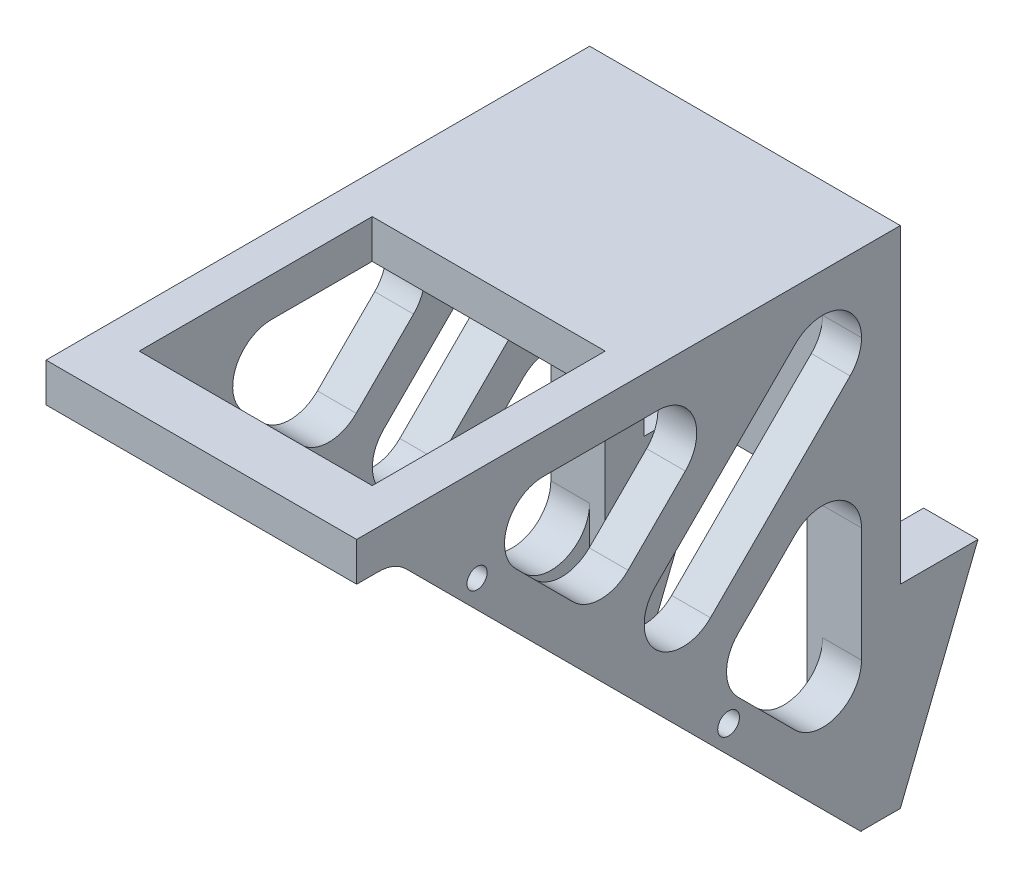
from build123d import *

# Parameters (mm, degrees)
ESQUISSE1_W             = 50.8
ESQUISSE1_H             = 82.55
BOSS_EXTRU_1_DEPTH      = 6.35
ESQUISSE2_W             = 50.8
ESQUISSE2_H             = 82.55
BOSS_EXTRU_2_DEPTH      = 6.35
ESQUISSE4_R             = 1.778
ESQUISSE4_R_2           = 1.651
BOSS_EXTRU_3_DEPTH      = 6.35
ESQUISSE5_W             = 38.1
ESQUISSE5_H             = 38.1
ENL_V_MAT_EXTRU_1_DEPTH = 6.35
ESQUISSE7_W             = 33.02
ESQUISSE7_H             = 44.45
ENL_V_MAT_EXTRU_2_DEPTH = 6.35
BOSS_EXTRU_4_DEPTH      = 8.89
CONG_1_R                = 6.35


with BuildPart() as part:
    # Esquisse1 → Boss.-Extru.1 (new body)
    with BuildSketch(Plane.XY):
        Rectangle(ESQUISSE1_W, ESQUISSE1_H)
    extrude(amount=BOSS_EXTRU_1_DEPTH)

    # Esquisse2 → Boss.-Extru.2 (add)
    with BuildSketch(Plane(origin=(0, 41.275, 0), x_dir=(1, 0, 0), z_dir=(0, 1, 0))):
        with Locations((0, -47.625)):
            Rectangle(ESQUISSE2_W, ESQUISSE2_H)
    extrude(amount=-BOSS_EXTRU_2_DEPTH)

    # Esquisse4 → Boss.-Extru.3 (add)
    with BuildSketch(Plane.ZY.offset(25.4)):
        Polygon((6.35, -32.426920908), (31.045704333, -7.731216575), (6.35, 16.964487758), (6.35, 25.944743879), (35.535832393, -3.241088515), (44.516088515, 5.739167607), (15.330256121, 34.925), (24.310512242, 34.925), (49.006216575, 10.229295667), (73.701920908, 34.925), (82.682177029, 34.925), (6.35, -41.407177029), align=None)
        with Locations(Location((28.082219813, -15.184829156, 0), (0, 0, 270))):
            Circle(ESQUISSE4_R, mode=Mode.SUBTRACT)
        with Locations(Location((69.211792847, 25.944743879, 0), (0, 0, 270))):
            Circle(ESQUISSE4_R_2, mode=Mode.SUBTRACT)
    boss_extru_3 = extrude(amount=-BOSS_EXTRU_3_DEPTH)

    # Symétrie1: Boss.-Extru.3 across plane
    add(boss_extru_3.mirror(Plane(origin=(0, 0, 0), x_dir=(0, 0, 1), z_dir=(1, 0, 0))))

    # Esquisse5 → Enlèv. mat.-Extru.1 (cut)
    with BuildSketch(Plane(origin=(0, 41.275, 0), x_dir=(1, 0, 0), z_dir=(0, 1, 0))):
        with Locations((0, -60.96)):
            Rectangle(ESQUISSE5_W, ESQUISSE5_H)
    extrude(amount=-ENL_V_MAT_EXTRU_1_DEPTH, mode=Mode.SUBTRACT)

    # Esquisse7 → Enlèv. mat.-Extru.2 (cut)
    with BuildSketch(Plane(origin=(0, 0, 0), x_dir=(-1, 0, 0), z_dir=(0, 0, -1))):
        with Locations((0, -19.05)):
            Rectangle(ESQUISSE7_W, ESQUISSE7_H)
    extrude(amount=-ENL_V_MAT_EXTRU_2_DEPTH, mode=Mode.SUBTRACT)

    # Esquisse8 → Boss.-Extru.4 (add)
    with BuildSketch(Plane(origin=(25.4, 0, 0), x_dir=(0, 0, -1), z_dir=(1, 0, 0))):
        Polygon((0, -41.275), (12.7, -9.525), (0, -9.525), align=None)
    boss_extru_4 = extrude(amount=-BOSS_EXTRU_4_DEPTH)

    # Symétrie2: Boss.-Extru.4 across plane
    add(boss_extru_4.mirror(Plane(origin=(0, 0, 0), x_dir=(0, 0, 1), z_dir=(1, 0, 0))))

    # Congé1
    cong_1_edges = [part.edges().sort_by_distance(p)[0] for p in [
        (0, 34.925, 6.35),
        (-22.225, -32.426920908, 6.35),
        (-22.225, -7.731216575, 31.045704333),
        (-22.225, 16.964487758, 6.35),
        (-22.225, 25.944743879, 6.35),
        (-22.225, -3.241088515, 35.535832393),
        (-22.225, 5.739167607, 44.516088515),
        (-22.225, 34.925, 15.330256121),
        (-22.225, 34.925, 24.310512242),
        (-22.225, 10.229295667, 49.006216575),
        (-22.225, 34.925, 73.701920908),
        (-22.225, 34.925, 82.682177029),
        (22.225, -32.426920908, 6.35),
        (22.225, 34.925, 82.682177029),
        (22.225, 34.925, 73.701920908),
        (22.225, 10.229295667, 49.006216575),
        (22.225, 34.925, 24.310512242),
        (22.225, 34.925, 15.330256121),
        (22.225, 5.739167607, 44.516088515),
        (22.225, -3.241088515, 35.535832393),
        (22.225, 25.944743879, 6.35),
        (22.225, 16.964487758, 6.35),
        (22.225, -7.731216575, 31.045704333),
    ]]
    fillet(cong_1_edges, radius=CONG_1_R - 0.0001)  # a hair under: the kernel refuses the full size


solid = part.part
